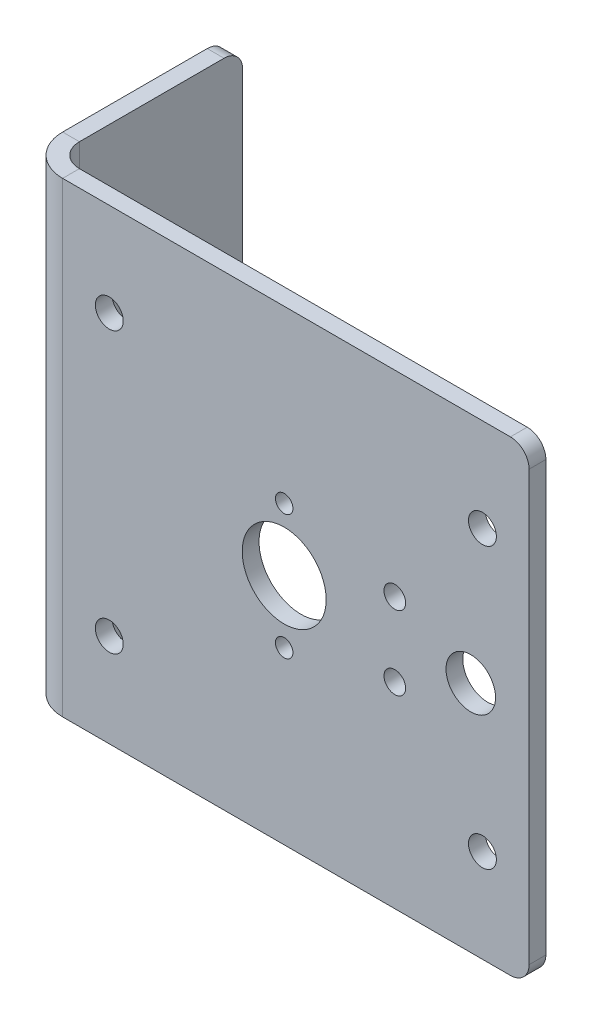
from build123d import *

# Parameters (mm, degrees)
BASE_FLANGE1_DEPTH               = 31.75
FILLET1_R                        = 2.54
F_25_0_1495_DIAMETER_HOLE1_D     = 3.7973
SKETCH10_R                       = 5.715
CUT_EXTRUDE1_DEPTH               = 56.168930099
F_17_64_0_26563_DIAMETER_HOLE1_D = 6.747002
F_3_32_0_09375_DIAMETER_HOLE1_D  = 2.38125
F_32_0_116_DIAMETER_HOLE1_D      = 2.9464


# Sheet-metal steps are written as plain solids
with BuildPart() as part:
    # Sketch3 → Base-Flange1 (new, symmetric)
    with BuildSketch(Plane(origin=(0, 0, 0), x_dir=(-1, 0, 0), z_dir=(0, 1, 0))):
        with BuildLine():
            Line((-33.3375, 0), (30.1625, 0))
            ThreePointArc((30.1625, 0), (32.40756403, -0.92993597), (33.3375, -3.175))
            Line((33.3375, -3.175), (33.3375, -25.4))
            Line((33.3375, -25.4), (35.6235, -25.4))
            Line((35.6235, -25.4), (35.6235, -3.175))
            ThreePointArc((35.6235, -3.175), (34.024010132, 0.686510132), (30.1625, 2.286))
            Line((30.1625, 2.286), (-33.3375, 2.286))
            Line((-33.3375, 2.286), (-33.3375, 0))
        make_face()
    extrude(amount=BASE_FLANGE1_DEPTH, both=True)

    # Fillet1
    fillet1_edges = [part.edges().sort_by_distance(p)[0] for p in [
        (33.3375, 31.75, 1.143),
        (33.3375, -31.75, 1.143),
        (-34.4805, 31.75, -25.4),
        (-34.4805, -31.75, -25.4),
    ]]
    fillet(fillet1_edges, radius=FILLET1_R)

    # #25 (0.1495) Diameter Hole1 (through all)
    with Locations(Plane.XY.offset(2.286)):
        with Locations((-23.8125, 19.05), (26.9875, 19.05), (26.9875, -19.05), (-23.8125, -19.05)):
            Hole(F_25_0_1495_DIAMETER_HOLE1_D / 2)

    # Sketch10 → Cut-Extrude1 (cut, through all)
    with BuildSketch(Plane.XY.offset(2.286)):
        Circle(SKETCH10_R)
    extrude(amount=-CUT_EXTRUDE1_DEPTH, mode=Mode.SUBTRACT)

    # 17/64 (0.26563) Diameter Hole1 (through all)
    with Locations(Plane.XY.offset(2.286)):
        with Locations((25.4, 0)):
            Hole(F_17_64_0_26563_DIAMETER_HOLE1_D / 2)

    # 3/32 (0.09375) Diameter Hole1 (through all)
    with Locations(Plane.XY.offset(2.286)):
        with Locations((0, 8.5), (0, -8.5)):
            Hole(F_3_32_0_09375_DIAMETER_HOLE1_D / 2)

    # #32 (0.116) Diameter Hole1 (through all)
    with Locations(Plane.XY.offset(2.286)):
        with Locations((15.057884182, 5.027499276), (15.057884182, -5.027499276)):
            Hole(F_32_0_116_DIAMETER_HOLE1_D / 2)


solid = part.part
